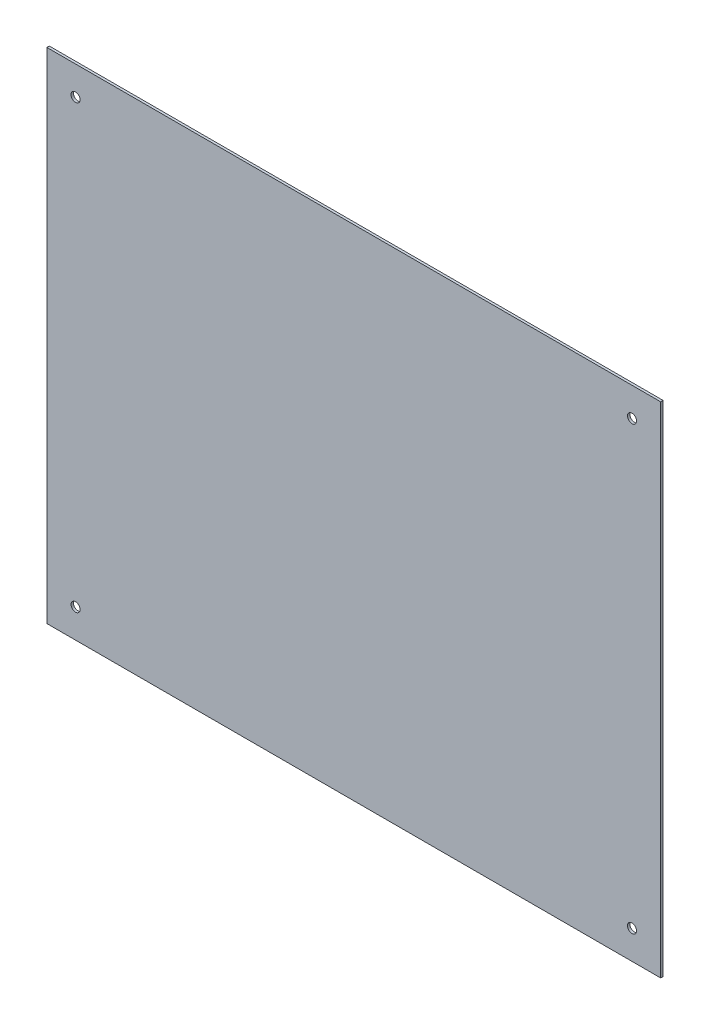
from build123d import *

# Parameters (mm, degrees)
SKETCH1_W               = 203
SKETCH1_H               = 165
BASE_EXTRUDE_DEPTH      = 0.4
HOLE1_START             = -0.4
HOLE1_OUTLINE_R         = 1.5
HOLE1_DEPTH             = 0.8
MIRROR2_START           = -0.4
MIRROR2_COPY_1_SKETCH_R = 1.5
MIRROR2_COPY_1_DEPTH    = 0.8


# Read off the part's stored shape, not the designer's step: Hole1
with BuildPart() as part:
    # Sketch1 → Base-Extrude (new, symmetric)
    with BuildSketch(Plane.XY):
        Rectangle(SKETCH1_W, SKETCH1_H)
    extrude(amount=BASE_EXTRUDE_DEPTH, both=True)

    # Hole1 outline → Hole1 (cut)
    with BuildSketch(Plane.XY.offset(HOLE1_START)):
        with Locations((-92, 73)):
            Circle(HOLE1_OUTLINE_R)
    hole1 = extrude(amount=HOLE1_DEPTH, mode=Mode.SUBTRACT)

    # Mirror1: Hole1 across plane
    add(hole1.mirror(Plane.ZX), mode=Mode.SUBTRACT)

    # Mirror2: Hole1 across plane
    add(hole1.mirror(Plane(origin=(0, 0, 0), x_dir=(0, 0, 1), z_dir=(1, 0, 0))), mode=Mode.SUBTRACT)

    # Mirror2 copy 1 sketch → Mirror2 copy 1 (cut)
    with BuildSketch(Plane(origin=(0, 0, 0), x_dir=(-1, 0, 0), z_dir=(0, 0, 1)).offset(MIRROR2_START)):
        with Locations((-92, 73)):
            Circle(MIRROR2_COPY_1_SKETCH_R)
    extrude(amount=MIRROR2_COPY_1_DEPTH, mode=Mode.SUBTRACT)


solid = part.part
